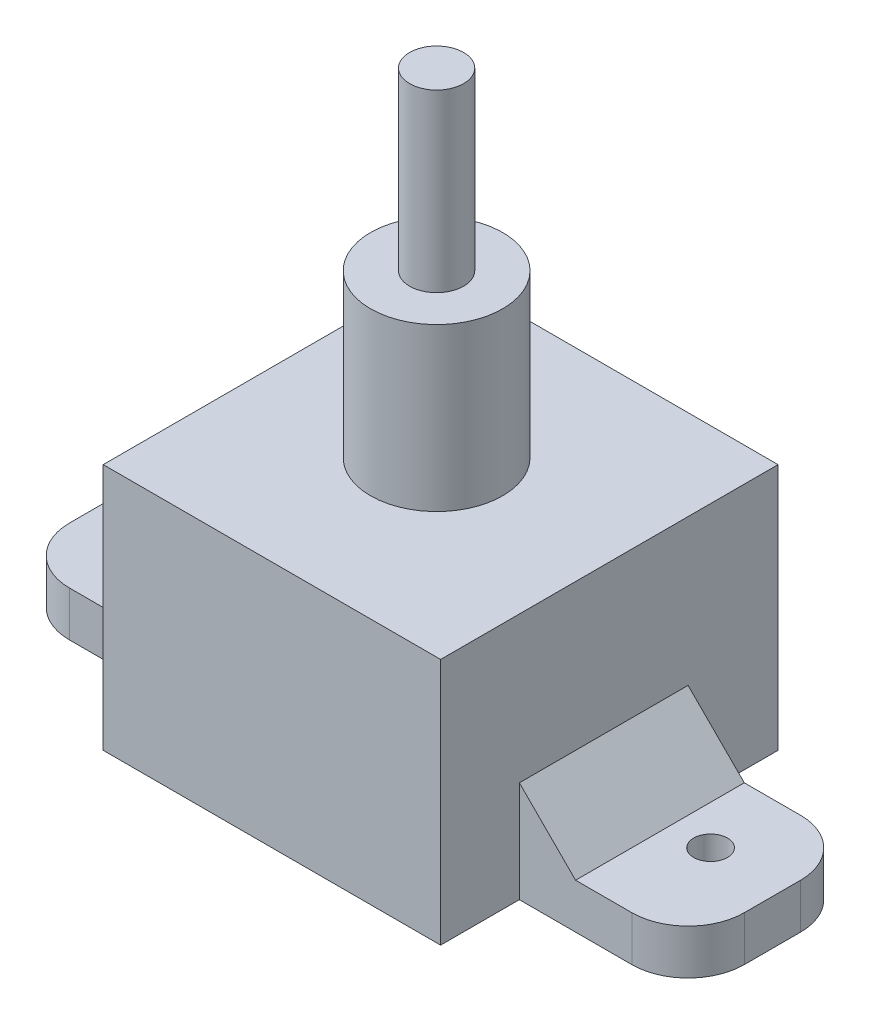
from build123d import *

# Parameters (mm, degrees)
SKETCH_1_W               = 30
SKETCH_1_H               = 30
EXTRUDE_289_DEPTH        = 22
SKETCH_2_R               = 5.875
EXTRUDE_2_DEPTH          = 14.4
SKETCH_4_R               = 2.4
EXTRUDE_3_DEPTH          = 15.6
EXTRUDE_4_DEPTH          = 4
CUT_EXTRUDE_2_DEPTH      = 60.018187939
CUT_EXTRUDE_2_DEPTH_BACK = 60.018187939
SKETCH_6_R               = 1.5
CHAMFER_2_SIZE           = 5
CHAMFER_3_SIZE           = 5


with BuildPart() as part:
    # Эскиз1 → Extrude 289 (new body)
    with BuildSketch(Plane(origin=(0, 0, 0), x_dir=(1, 0, 0), z_dir=(0, 1, 0))):
        with Locations((0.713469456, -0.356734728)):
            Rectangle(SKETCH_1_W, SKETCH_1_H)
    extrude(amount=EXTRUDE_289_DEPTH)

    # Эскиз2 → Бобышка-Вытянуть2 (add)
    with BuildSketch(Plane(origin=(0, 22, 0), x_dir=(1, 0, 0), z_dir=(0, 1, 0))):
        Circle(SKETCH_2_R)
    extrude(amount=EXTRUDE_2_DEPTH)

    # Эскиз4 → Бобышка-Вытянуть3 (add)
    with BuildSketch(Plane(origin=(0, 36.4, 0), x_dir=(1, 0, 0), z_dir=(0, 1, 0))):
        Circle(SKETCH_4_R)
    extrude(amount=EXTRUDE_3_DEPTH)

    # Эскиз5 → Бобышка-Вытянуть4 (add)
    with BuildSketch(Plane.XZ):
        with BuildLine():
            Line((15.713469456, 8.356734728), (25.713469456, 8.356734728))
            ThreePointArc((25.713469456, 8.356734728), (29.249003362, 6.892268634), (30.713469456, 3.356734728))
            Line((30.713469456, 3.356734728), (30.713469456, -1.643265272))
            ThreePointArc((30.713469456, -1.643265272), (29.249003362, -5.178799178), (25.713469456, -6.643265272))
            Line((25.713469456, -6.643265272), (15.713469456, -6.643265272))
            Line((15.713469456, -6.643265272), (15.713469456, 8.356734728))
        make_face()
        with BuildLine():
            Line((-14.286530544, 8.356734728), (-24.286530544, 8.356734728))
            ThreePointArc((-24.286530544, 8.356734728), (-27.82206445, 6.892268634), (-29.286530544, 3.356734728))
            Line((-29.286530544, 3.356734728), (-29.286530544, -1.643265272))
            ThreePointArc((-29.286530544, -1.643265272), (-27.82206445, -5.178799178), (-24.286530544, -6.643265272))
            Line((-24.286530544, -6.643265272), (-14.286530544, -6.643265272))
            Line((-14.286530544, -6.643265272), (-14.286530544, 8.356734728))
        make_face()
    extrude(amount=-EXTRUDE_4_DEPTH)

    # Эскиз6 → Вырез-Вытянуть2 (cut, two sides: drawn at the far end of the back side and taken through both)
    with BuildSketch(Plane(origin=(0, 4, 0), x_dir=(1, 0, 0), z_dir=(0, 1, 0)).offset(-CUT_EXTRUDE_2_DEPTH_BACK)):
        with Locations((24.213469456, 0.143265272)):
            Circle(SKETCH_6_R)
        with Locations((-22.786530544, 0.143265272)):
            Circle(SKETCH_6_R)
    extrude(amount=CUT_EXTRUDE_2_DEPTH + CUT_EXTRUDE_2_DEPTH_BACK, mode=Mode.SUBTRACT)

    # Фаска2
    chamfer_2_edges = [part.edges().sort_by_distance(p)[0] for p in [
        (15.713469456, 4, 0.856734728),
    ]]
    chamfer(chamfer_2_edges, length=CHAMFER_2_SIZE)

    # Фаска3
    chamfer_3_edges = [part.edges().sort_by_distance(p)[0] for p in [
        (-14.286530544, 4, 0.856734728),
    ]]
    chamfer(chamfer_3_edges, length=CHAMFER_3_SIZE)


solid = part.part
